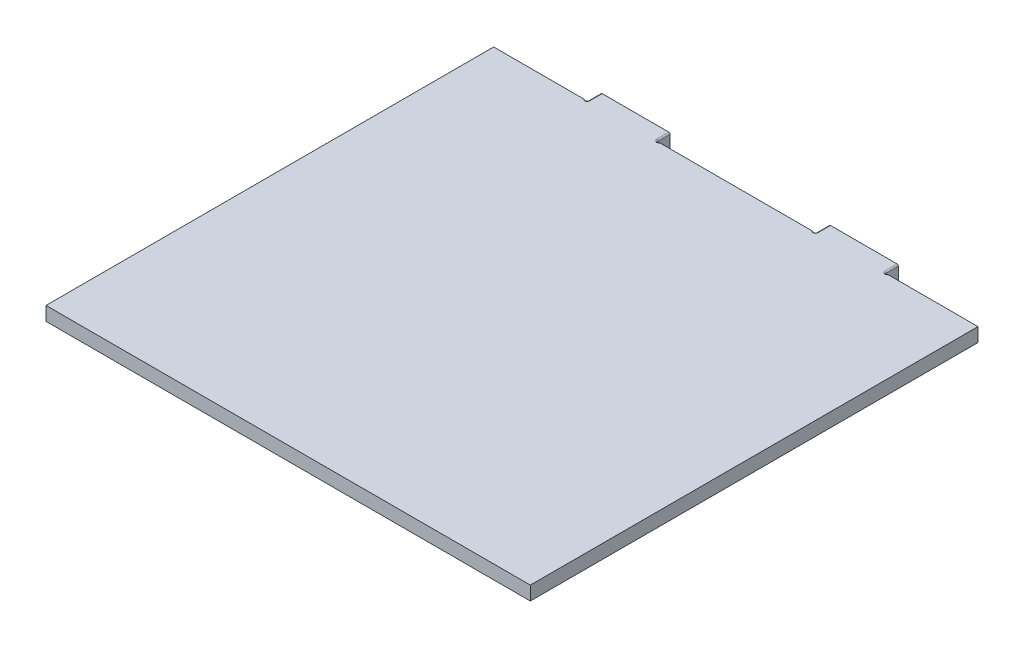
from build123d import *

# Parameters (mm, degrees)
SKETCH1_W           = 70
SKETCH1_H           = 64.7
BOSS_EXTRUDE1_DEPTH = 2
SKETCH2_W           = 10
SKETCH2_H           = 10
SKETCH2_W_2         = 5
SKETCH2_H_2         = 4
BOSS_EXTRUDE2_DEPTH = 2
FILLET2_R           = 0.2


with BuildPart() as part:
    # Sketch1 → Boss-Extrude1 (new body)
    with BuildSketch(Plane(origin=(0, 0, 0), x_dir=(1, 0, 0), z_dir=(0, 1, 0))):
        with Locations((35, 32.35)):
            Rectangle(SKETCH1_W, SKETCH1_H)
    extrude(amount=BOSS_EXTRUDE1_DEPTH)

    # Sketch2 → Boss-Extrude2 (add)
    # profile 1 of 2: a face of its own
    with BuildSketch(Plane(origin=(0, 0, -64.7), x_dir=(-1, 0, 0), z_dir=(0, 0, -1))):
        with Locations((-51.5, -3)):
            Rectangle(SKETCH2_W, SKETCH2_H)
        with Locations((-51.5, -3)):
            Rectangle(SKETCH2_W_2, SKETCH2_H_2, mode=Mode.SUBTRACT)
    # profile 2 of 2: a face of its own
    with BuildSketch(Plane(origin=(0, 0, -64.7), x_dir=(-1, 0, 0), z_dir=(0, 0, -1))):
        with Locations((-18.5, -3)):
            Rectangle(SKETCH2_W, SKETCH2_H)
        with Locations((-18.5, -3)):
            Rectangle(SKETCH2_W_2, SKETCH2_H_2, mode=Mode.SUBTRACT)
    extrude(amount=BOSS_EXTRUDE2_DEPTH)

    # Fillet2
    # the kernel refuses this fillet: 0.2 mm, written as the material it adds along each edge
    with BuildSketch(Plane(origin=(13.5, 0, -64.7), x_dir=(-1, 0, 0), z_dir=(0, 1, 0)), Plane(origin=(23.5, 2, -64.7), x_dir=(1, 0, 0), z_dir=(0, -1, 0)), Plane(origin=(21, -5, -64.7), x_dir=(0, 1, 0), z_dir=(0, 0, -1)), Plane(origin=(16, -5, -64.7), x_dir=(1, 0, 0), z_dir=(0, 0, -1)), Plane(origin=(49, -5, -64.7), x_dir=(1, 0, 0), z_dir=(0, 0, -1)), Plane(origin=(49, -1, -64.7), x_dir=(0, -1, 0), z_dir=(0, 0, -1))) as fillet2_piece_1:
        with BuildLine():
            CenterArc((FILLET2_R, -FILLET2_R), FILLET2_R, 90, 90)
            Line((0, -FILLET2_R), (0, 0))
            Line((0, 0), (FILLET2_R, 0))
        make_face()
    extrude(amount=2)
    with BuildSketch(Plane(origin=(56.5, 0, -64.7), x_dir=(1, 0, 0), z_dir=(0, 1, 0)), Plane(origin=(46.5, 2, -64.7), x_dir=(-1, 0, 0), z_dir=(0, -1, 0)), Plane(origin=(21, -1, -64.7), x_dir=(0, -1, 0), z_dir=(0, 0, -1)), Plane(origin=(16, -1, -64.7), x_dir=(1, 0, 0), z_dir=(0, 0, -1)), Plane(origin=(54, -1, -64.7), x_dir=(0, -1, 0), z_dir=(0, 0, -1)), Plane(origin=(54, -5, -64.7), x_dir=(-1, 0, 0), z_dir=(0, 0, -1))) as fillet2_piece_2:
        with BuildLine():
            CenterArc((FILLET2_R, FILLET2_R), FILLET2_R, 180, 90)
            Line((0, FILLET2_R), (0, 0))
            Line((0, 0), (FILLET2_R, 0))
        make_face()
    extrude(amount=2)
    # the kernel refuses this fillet: 0.2 mm, written as the material it takes off along each edge
    with BuildSketch(Plane(origin=(13.5, 2, -64.9), x_dir=(1, 0, 0), z_dir=(0, 0, -1)), Plane(origin=(46.5, 2, -64.9), x_dir=(1, 0, 0), z_dir=(0, 0, -1))) as fillet2_2_piece_1:
        with BuildLine():
            CenterArc((FILLET2_R, FILLET2_R), FILLET2_R, 180, 90)
            Line((0, FILLET2_R), (0, 0))
            Line((0, 0), (FILLET2_R, 0))
        make_face()
    extrude(amount=2.3, mode=Mode.SUBTRACT)
    with BuildSketch(Plane(origin=(13.5, -8, -64.2), x_dir=(0, 1, 0), z_dir=(0, 0, -1)), Plane(origin=(46.5, -8, -64.2), x_dir=(0, 1, 0), z_dir=(0, 0, -1))) as fillet2_2_piece_2:
        with BuildLine():
            CenterArc((FILLET2_R, FILLET2_R), FILLET2_R, 180, 90)
            Line((0, FILLET2_R), (0, 0))
            Line((0, 0), (FILLET2_R, 0))
        make_face()
    extrude(amount=3, mode=Mode.SUBTRACT)
    with BuildSketch(Plane(origin=(23.5, -8, -64.2), x_dir=(0, 1, 0), z_dir=(0, 0, -1)), Plane(origin=(56.5, -8, -64.2), x_dir=(0, 1, 0), z_dir=(0, 0, -1))) as fillet2_2_piece_3:
        with BuildLine():
            CenterArc((FILLET2_R, -FILLET2_R), FILLET2_R, 90, 90)
            Line((0, -FILLET2_R), (0, 0))
            Line((0, 0), (FILLET2_R, 0))
        make_face()
    extrude(amount=3, mode=Mode.SUBTRACT)
    with BuildSketch(Plane(origin=(23.5, 2, -64.9), x_dir=(-1, 0, 0), z_dir=(0, 0, -1)), Plane(origin=(56.5, 2, -64.9), x_dir=(-1, 0, 0), z_dir=(0, 0, -1))) as fillet2_2_piece_4:
        with BuildLine():
            CenterArc((FILLET2_R, -FILLET2_R), FILLET2_R, 90, 90)
            Line((0, -FILLET2_R), (0, 0))
            Line((0, 0), (FILLET2_R, 0))
        make_face()
    extrude(amount=2.3, mode=Mode.SUBTRACT)
    with BuildSketch(Plane(origin=(46.3, 2, -64.9), x_dir=(-0.5976672776327815, 0, -0.8017442392976825), z_dir=(0.8017442392976825, 0, -0.5976672776327815))) as fillet2_2_piece_5:
        with BuildLine():
            CenterArc((0.2 + FILLET2_R, -FILLET2_R), FILLET2_R, 90, 90)
            Line((0.2, -FILLET2_R), (0.2, 0))
            Line((0.2, 0), (0.2 + FILLET2_R, 0))
        make_face()
    revolve(axis=Axis((46.3, 2, -64.9), (0, 1, 0)), revolution_arc=233.296989237, mode=Mode.SUBTRACT)
    with BuildSketch(Plane(origin=(56.7, 2, -64.9), x_dir=(0.5976672776327815, 0, -0.8017442392976825), z_dir=(-0.8017442392976825, 0, -0.5976672776327815))) as fillet2_2_piece_6:
        with BuildLine():
            CenterArc((0.2 + FILLET2_R, FILLET2_R), FILLET2_R, 180, 90)
            Line((0.2, FILLET2_R), (0.2, 0))
            Line((0.2, 0), (0.2 + FILLET2_R, 0))
        make_face()
    revolve(axis=Axis((56.7, 2, -64.9), (0, -1, 0)), revolution_arc=233.296989237, mode=Mode.SUBTRACT)
    with BuildSketch(Plane(origin=(23.7, 2, -64.9), x_dir=(0.5976672776328044, 0, -0.8017442392976655), z_dir=(-0.8017442392976655, 0, -0.5976672776328044))) as fillet2_2_piece_7:
        with BuildLine():
            CenterArc((0.2 + FILLET2_R, FILLET2_R), FILLET2_R, 180, 90)
            Line((0.2, FILLET2_R), (0.2, 0))
            Line((0.2, 0), (0.2 + FILLET2_R, 0))
        make_face()
    revolve(axis=Axis((23.7, 2, -64.9), (0, -1, 0)), revolution_arc=233.296989237, mode=Mode.SUBTRACT)
    with BuildSketch(Plane(origin=(13.3, 2, -64.9), x_dir=(-0.5976672776327986, 0, -0.8017442392976697), z_dir=(0.8017442392976697, 0, -0.5976672776327986))) as fillet2_2_piece_8:
        with BuildLine():
            CenterArc((0.2 + FILLET2_R, -FILLET2_R), FILLET2_R, 90, 90)
            Line((0.2, -FILLET2_R), (0.2, 0))
            Line((0.2, 0), (0.2 + FILLET2_R, 0))
        make_face()
    revolve(axis=Axis((13.3, 2, -64.9), (0, 1, 0)), revolution_arc=233.296989237, mode=Mode.SUBTRACT)


solid = part.part
